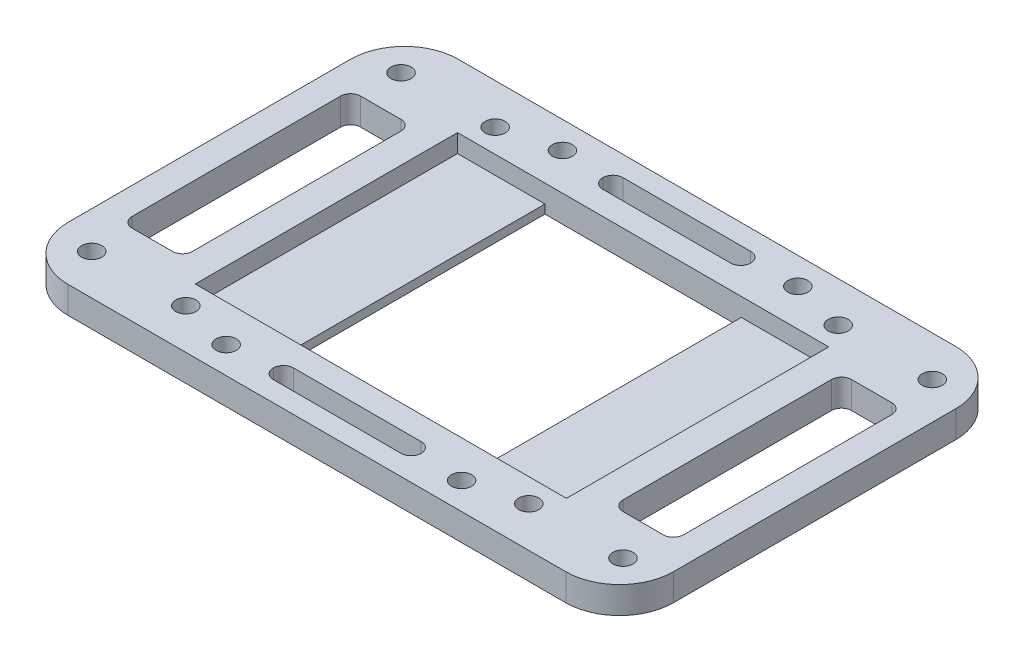
from build123d import *

# Parameters (mm, degrees)
SKETCH_1_W          = 90
SKETCH_1_H          = 58
SKETCH_1_R          = 1.5
EXTRUDE_1_DEPTH     = 4
SKETCH_2_W          = 55.2
SKETCH_2_H          = 39
CUT_EXTRUDE_1_DEPTH = 4
SKETCH_13_R         = 1.5
CUT_EXTRUDE_6_DEPTH = 4
SKETCH_14_W         = 9
SKETCH_14_H         = 34
SKETCH_14_W_2       = 22
SKETCH_14_H_2       = 3
CUT_EXTRUDE_7_DEPTH = 4
FILLET_1_R          = 8
FILLET_2_R          = 1.5
SKETCH_18_W         = 15.4
SKETCH_18_H         = 40
EXTRUDE_4_DEPTH     = 1.3
EXTRUDE_4_2_DEPTH   = 1.3


with BuildPart() as part:
    # 草图1 → 凸台-拉伸1 (new body)
    with BuildSketch(Plane(origin=(0, 0, 0), x_dir=(1, 0, 0), z_dir=(0, 1, 0))):
        Rectangle(SKETCH_1_W, SKETCH_1_H)
        with Locations(Location((-25.5, 23, 0), (0, 0, 270))):
            Circle(SKETCH_1_R, mode=Mode.SUBTRACT)
        with Locations(Location((39.5, 23, 0), (0, 0, 270))):
            Circle(SKETCH_1_R, mode=Mode.SUBTRACT)
        with Locations(Location((-25.5, -23, 0), (0, 0, 270))):
            Circle(SKETCH_1_R, mode=Mode.SUBTRACT)
        with Locations(Location((39.5, -23, 0), (0, 0, 270))):
            Circle(SKETCH_1_R, mode=Mode.SUBTRACT)
        with Locations(Location((-39.5, 23, 0), (0, 0, 270))):
            Circle(SKETCH_1_R, mode=Mode.SUBTRACT)
        with Locations(Location((-39.5, -23, 0), (0, 0, 270))):
            Circle(SKETCH_1_R, mode=Mode.SUBTRACT)
        with Locations(Location((25.5, -23, 0), (0, 0, 270))):
            Circle(SKETCH_1_R, mode=Mode.SUBTRACT)
        with Locations(Location((25.5, 23, 0), (0, 0, 270))):
            Circle(SKETCH_1_R, mode=Mode.SUBTRACT)
    extrude(amount=EXTRUDE_1_DEPTH)

    # 草图2 → 切除-拉伸1 (cut)
    with BuildSketch(Plane(origin=(0, 4, 0), x_dir=(1, 0, 0), z_dir=(0, 1, 0))):
        Rectangle(SKETCH_2_W, SKETCH_2_H)
    extrude(amount=-CUT_EXTRUDE_1_DEPTH, mode=Mode.SUBTRACT)

    # 草图13 → 切除-拉伸6 (cut)
    with BuildSketch(Plane.XZ):
        with Locations(Location((-17.5, 25, 0), (0, 0, 270))):
            Circle(SKETCH_13_R)
        with Locations(Location((17.5, 25, 0), (0, 0, 270))):
            Circle(SKETCH_13_R)
        with Locations(Location((-17.5, -25, 0), (0, 0, 270))):
            Circle(SKETCH_13_R)
        with Locations(Location((17.5, -25, 0), (0, 0, 270))):
            Circle(SKETCH_13_R)
    extrude(amount=-CUT_EXTRUDE_6_DEPTH, mode=Mode.SUBTRACT)

    # 草图14 → 切除-拉伸7 (cut)
    with BuildSketch(Plane(origin=(0, 4, 0), x_dir=(1, 0, 0), z_dir=(0, 1, 0))):
        with Locations((36.5, 0)):
            Rectangle(SKETCH_14_W, SKETCH_14_H)
        with Locations((-36.5, 0)):
            Rectangle(SKETCH_14_W, SKETCH_14_H)
        with Locations((0, 24.5)):
            Rectangle(SKETCH_14_W_2, SKETCH_14_H_2)
        with Locations((0, -24.5)):
            Rectangle(SKETCH_14_W_2, SKETCH_14_H_2)
    extrude(amount=-CUT_EXTRUDE_7_DEPTH, mode=Mode.SUBTRACT)

    # 圆角1
    fillet_1_edges = [part.edges().sort_by_distance(p)[0] for p in [
        (45, 2, 29),
        (-45, 2, 29),
        (-45, 2, -29),
        (45, 2, -29),
    ]]
    fillet(fillet_1_edges, radius=FILLET_1_R)

    # 圆角2
    fillet_2_edges = [part.edges().sort_by_distance(p)[0] for p in [
        (11, 2, 23),
        (-11, 2, 23),
        (11, 2, 26),
        (-11, 2, 26),
        (-11, 2, -23),
        (11, 2, -23),
        (11, 2, -26),
        (-11, 2, -26),
        (41, 2, 17),
        (32, 2, 17),
        (41, 2, -17),
        (32, 2, -17),
        (-41, 2, 17),
        (-32, 2, 17),
        (-32, 2, -17),
        (-41, 2, -17),
    ]]
    fillet(fillet_2_edges, radius=FILLET_2_R - 0.0001)  # a hair under: the kernel refuses the full size


with BuildPart() as body_2:
    # 草图18 → 凸台-拉伸4 (new body)
    with BuildSketch(Plane.XZ):
        with Locations((-22.3, 0)):
            Rectangle(SKETCH_18_W, SKETCH_18_H)
    extrude(amount=-EXTRUDE_4_DEPTH)


with BuildPart() as body_3:
    # 草图18 → Extrude 4 2 (new body)
    with BuildSketch(Plane.XZ):
        with Locations((22.3, 0)):
            Rectangle(SKETCH_18_W, SKETCH_18_H)
    extrude(amount=-EXTRUDE_4_2_DEPTH)


solid = Compound([part.part, body_2.part, body_3.part])
